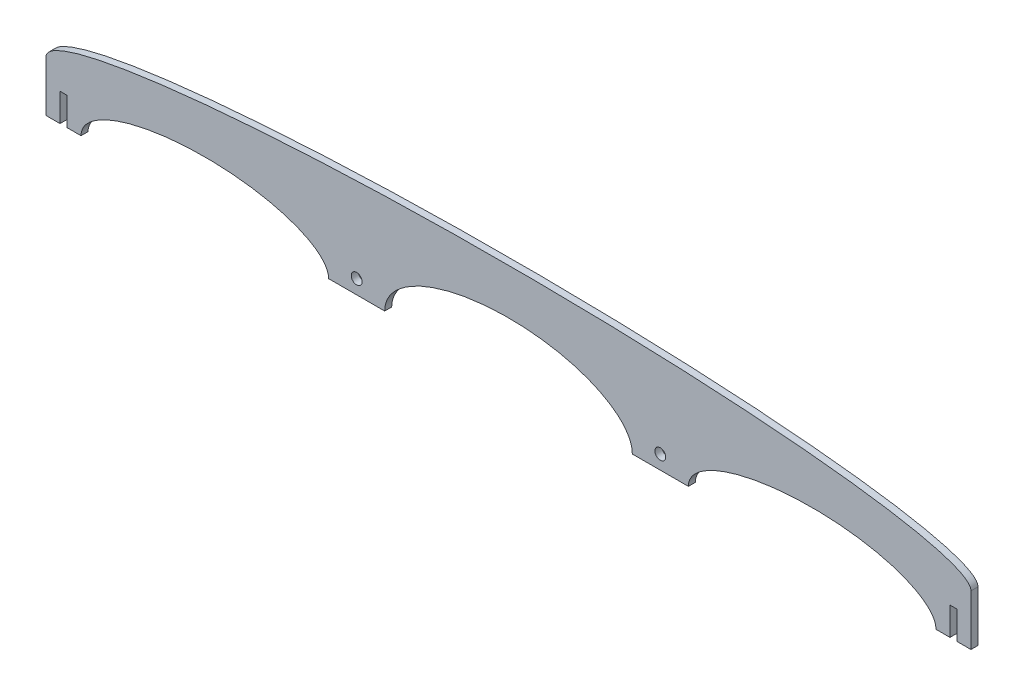
from build123d import *

# Parameters (mm, degrees)
BOSS_EXTRUDE1_DEPTH              = 3.175
F_10_0_1935_DIAMETER_HOLE1_D     = 4.9149
F_10_0_1935_DIAMETER_HOLE1_DEPTH = 19.001994
F_10_0_1935_DIAMETER_HOLE1_TIP   = 1.476584928


with BuildPart() as part:
    # Sketch1 → Boss-Extrude1 (new body)
    with BuildSketch(Plane.XY):
        with BuildLine():
            Line((-209.55, 0), (-209.55, -23.01875))
            Line((-209.55, -23.01875), (-203.2, -23.01875))
            Line((-203.2, -23.01875), (-203.2, -10.31875))
            Line((-203.2, -10.31875), (-200.025, -10.31875))
            Line((-200.025, -10.31875), (-200.025, -23.01875))
            Line((-200.025, -23.01875), (-193.675, -23.01875))
            add(Edge.make_bspline(
                [(-81.491666667, -23.01875), (-81.491666667, -3.27517329), (-137.583333333, -3.27517329), (-193.675, -3.27517329), (-193.675, -23.01875)],
                knots=[0, 0, 0, 1.570796327, 1.570796327, 3.141592654, 3.141592654, 3.141592654], degree=2, weights=[1, 0.707106781, 1, 0.707106781, 1]))
            Line((-81.491666667, -23.01875), (-56.091666667, -23.01875))
            add(Edge.make_bspline(
                [(56.091666667, -23.01875), (56.091666667, 2.38125), (0, 2.38125), (-56.091666667, 2.38125), (-56.091666667, -23.01875)],
                knots=[3.141592654, 3.141592654, 3.141592654, 4.71238898, 4.71238898, 6.283185307, 6.283185307, 6.283185307], degree=2, weights=[1, 0.707106781, 1, 0.707106781, 1]))
            Line((56.091666667, -23.01875), (81.491666667, -23.01875))
            add(Edge.make_bspline(
                [(193.675, -23.01875), (193.675, -3.27517329), (137.583333333, -3.27517329), (81.491666667, -3.27517329), (81.491666667, -23.01875)],
                knots=[3.141592654, 3.141592654, 3.141592654, 4.71238898, 4.71238898, 6.283185307, 6.283185307, 6.283185307], degree=2, weights=[1, 0.707106781, 1, 0.707106781, 1]))
            Line((193.675, -23.01875), (200.025, -23.01875))
            Line((200.025, -23.01875), (200.025, -10.31875))
            Line((200.025, -10.31875), (203.2, -10.31875))
            Line((203.2, -10.31875), (203.2, -23.01875))
            Line((203.2, -23.01875), (209.55, -23.01875))
            Line((209.55, -23.01875), (209.55, 0))
            add(Edge.make_bspline(
                [(209.55, 0), (209.55, 23.01875), (0, 23.01875), (-209.55, 23.01875), (-209.55, 0)],
                knots=[3.141592654, 3.141592654, 3.141592654, 4.71238898, 4.71238898, 6.283185307, 6.283185307, 6.283185307], degree=2, weights=[1, 0.707106781, 1, 0.707106781, 1]))
        make_face()
    extrude(amount=BOSS_EXTRUDE1_DEPTH)

    # #10 (0.1935) Diameter Hole1
    with Locations(Plane.XY.offset(3.175)):
        with Locations((-68.791666667, -16.66875), (68.791666667, -16.66875)):
            Hole(F_10_0_1935_DIAMETER_HOLE1_D / 2, depth=F_10_0_1935_DIAMETER_HOLE1_DEPTH)
            with Locations((0, 0, -(F_10_0_1935_DIAMETER_HOLE1_DEPTH + F_10_0_1935_DIAMETER_HOLE1_TIP / 2))):  # 118° drill point
                Cone(0, F_10_0_1935_DIAMETER_HOLE1_D / 2, F_10_0_1935_DIAMETER_HOLE1_TIP, mode=Mode.SUBTRACT)


solid = part.part
